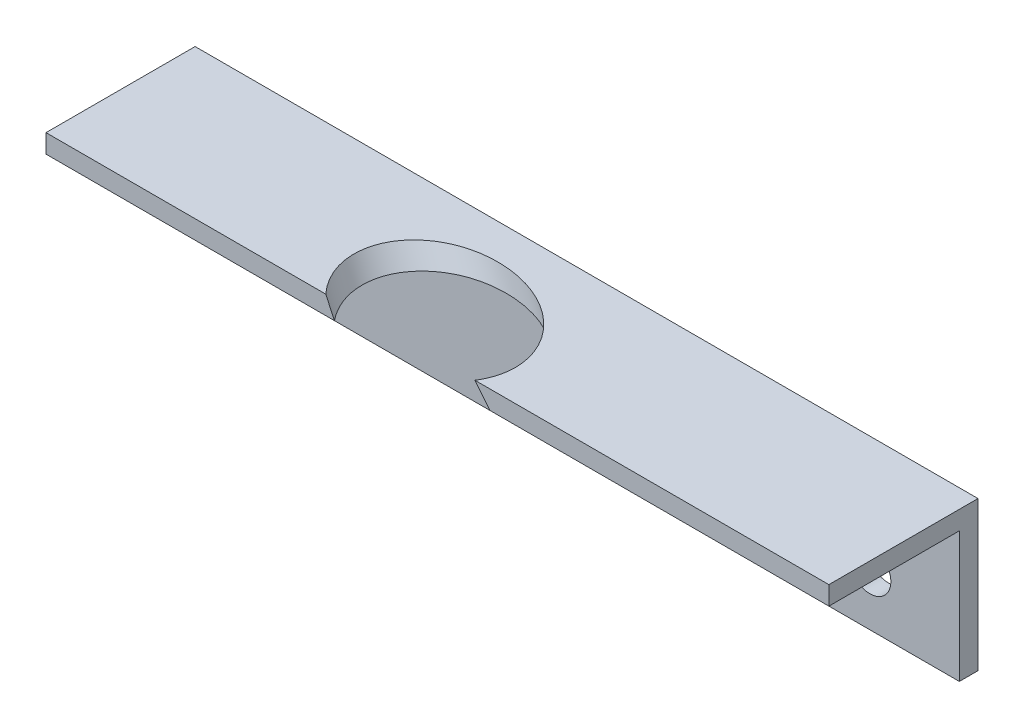
from build123d import *

# Parameters (mm, degrees)
BOSS_EXTRUDE1_DEPTH = 133.35
SKETCH5_R           = 3.57124
CUT_EXTRUDE1_DEPTH  = 139.103376269


with BuildPart() as part:
    # Sketch1 → Boss-Extrude1 (new body)
    with BuildSketch(Plane(origin=(0, 0, 0), x_dir=(0, 0, -1), z_dir=(1, 0, 0))):
        Polygon((0, 0), (0, 25.4), (-25.4, 25.4), (-25.4, 22.225), (-3.175, 22.225), (-3.175, 0), align=None)
    extrude(amount=BOSS_EXTRUDE1_DEPTH)

    # Cut-Sweep1: read off the stored shape, not the designer's step
    # Cut-Sweep1: loft between two sections, ruled curve by curve
    cut_sweep1_from = [
        Edge.make_bspline([(317.515141944, -384.873460742, 110.314894304), (318.529967826, -386.50832307, 135.641902686), (340.110332702, -373.112508356, 135.641902686), (339.095506819, -371.477646028, 110.314894304), (338.080680937, -369.8427837, 84.987885922), (316.500316061, -383.238598413, 84.987885922), (317.515141944, -384.873460742, 110.314894304)], [0, 0, 0, 0, 0.5, 0.5, 0.5, 1, 1, 1, 1], 3, [1, 0.333333333, 0.333333333, 1, 0.333333333, 0.333333333, 1]),
    ]
    cut_sweep1_to = [
        Edge.make_bspline([(-268.15000351, 494.008408115, -89.503953221), (-267.135177627, 492.373545787, -64.176944839), (-245.554812752, 505.769360501, -64.176944839), (-246.569638634, 507.404222829, -89.503953221), (-247.584464517, 509.039085157, -114.830961603), (-269.164829392, 495.643270444, -114.830961603), (-268.15000351, 494.008408115, -89.503953221)], [0, 0, 0, 0, 0.5, 0.5, 0.5, 1, 1, 1, 1], 3, [1, 0.333333333, 0.333333333, 1, 0.333333333, 0.333333333, 1]),
    ]
    cut_sweep1 = Solid(Shell([*[Face.make_surface_from_curves(cut_sweep1_from[k], cut_sweep1_to[k]) for k in range(1)], Face(Wire(cut_sweep1_from)), Face(Wire(cut_sweep1_to))]))
    add(cut_sweep1, mode=Mode.SUBTRACT)

    # Sketch5 → Cut-Extrude1 (cut, through all)
    with BuildSketch(Plane(origin=(0, 0, 0), x_dir=(-1, 0, 0), z_dir=(0, 0, -1))):
        with Locations((-118.11, 8.89)):
            Circle(SKETCH5_R)
        with Locations((-15.24, 8.89)):
            Circle(SKETCH5_R)
    extrude(amount=-CUT_EXTRUDE1_DEPTH, mode=Mode.SUBTRACT)


solid = part.part
